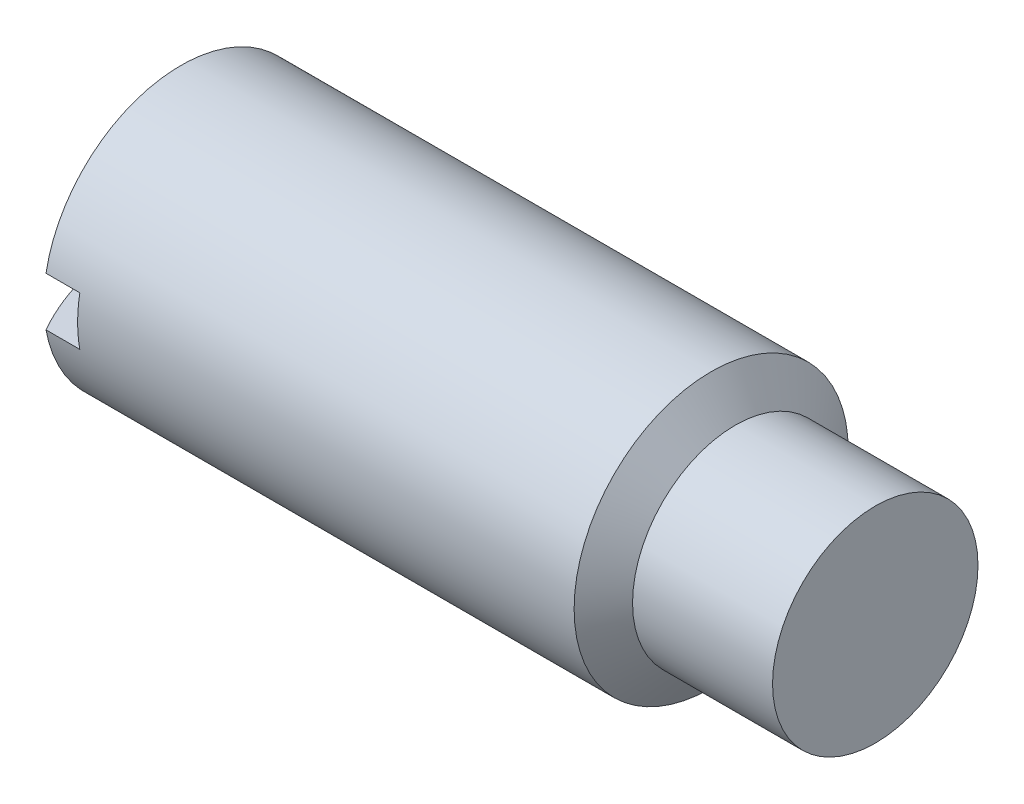
from build123d import *

# Parameters (mm, degrees)
SKETCH2_W  = 19.05
SKETCH2_H  = 3.4036
SLOT_DEPTH = 4.9022


with BuildPart() as part:
    # BodySke → BaseBody (revolve)
    with BuildSketch(Plane.XY):
        with BuildLine():
            Line((41.0718, 7.1374), (50.8, 7.1374))
            Line((50.8, 7.1374), (50.8, 0))
            Line((50.8, 0), (0, 0))
            ThreePointArc((0, 0), (0.649113009, 4.930502809), (2.552216058, 9.525))
            Line((2.552216058, 9.525), (39.399984482, 9.525))
            Line((39.399984482, 9.525), (41.0718, 7.1374))
        make_face()
    revolve(axis=Axis((-12.7, 0, 0), (1, 0, 0)))

    # Sketch2 → Slot (cut)
    with BuildSketch(Plane(origin=(0, 0, 0), x_dir=(0, 0, -1), z_dir=(1, 0, 0))):
        Rectangle(SKETCH2_W, SKETCH2_H)
    extrude(amount=SLOT_DEPTH, mode=Mode.SUBTRACT)


solid = part.part
